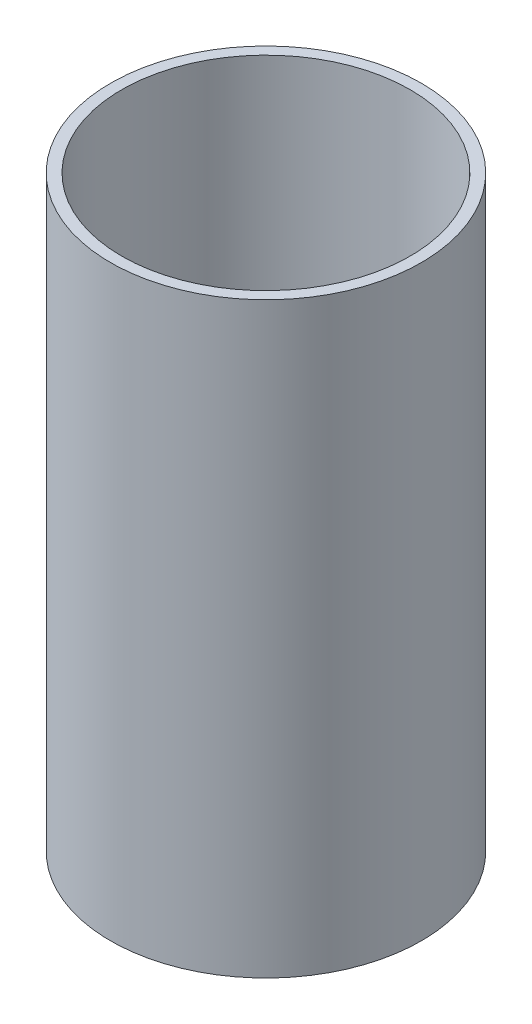
from build123d import *

# Parameters (mm, degrees)
SKETCH1_R           = 44.45
SKETCH1_R_2         = 41.25
BOSS_EXTRUDE1_DEPTH = 168


with BuildPart() as part:
    # Sketch1 → Boss-Extrude1 (new body)
    with BuildSketch(Plane(origin=(0, 0, 0), x_dir=(1, 0, 0), z_dir=(0, 1, 0))):
        Circle(SKETCH1_R)
        Circle(SKETCH1_R_2, mode=Mode.SUBTRACT)
    extrude(amount=BOSS_EXTRUDE1_DEPTH)


solid = part.part
